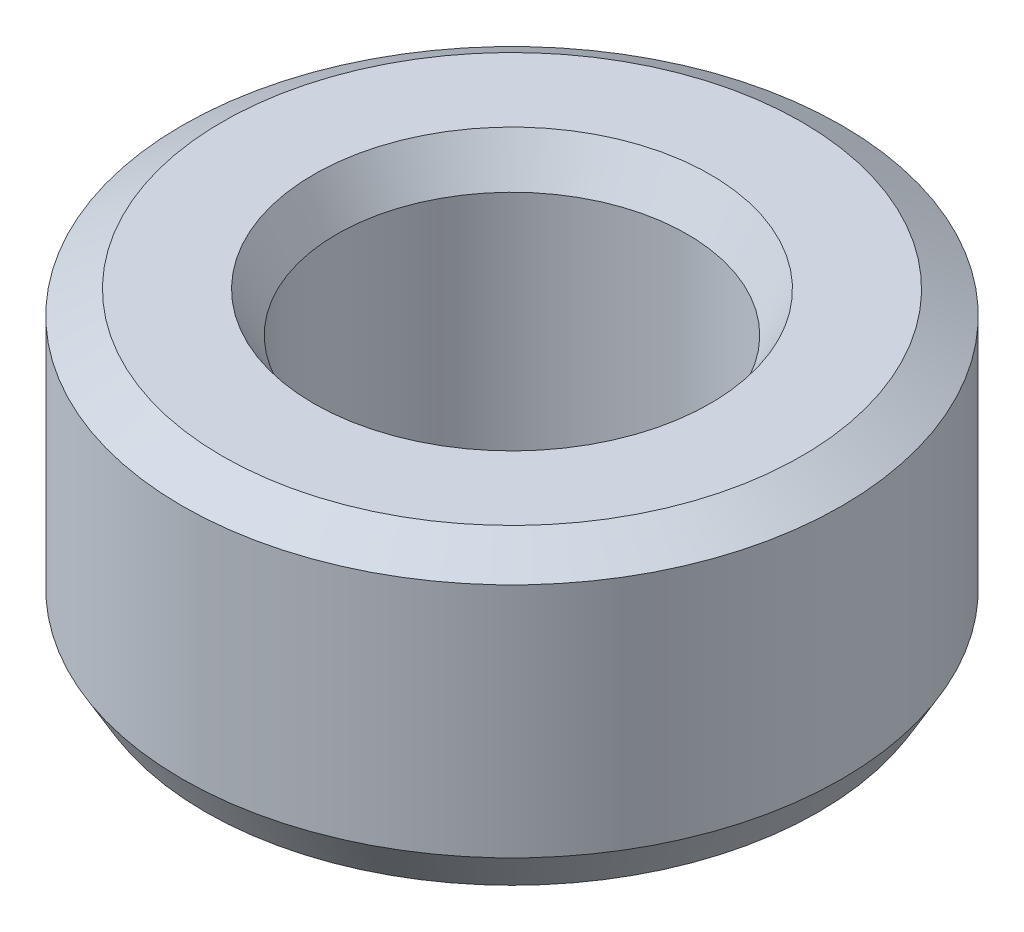
from build123d import *
from OCP.BRepFilletAPI import BRepFilletAPI_MakeChamfer

# Parameters (mm, degrees)
SKETCH1_R           = 12.5
BOSS_EXTRUDE1_DEPTH = 11.361416281
SKETCH2_R           = 6.64244607
CUT_EXTRUDE1_DEPTH  = 22.013847337
CHAMFER1_SIZE       = 0.877414403
CHAMFER1_SIZE2      = 1.519726325


with BuildPart() as part:
    # Sketch1 → Boss-Extrude1 (new body)
    with BuildSketch(Plane(origin=(0, 0, 0), x_dir=(1, 0, 0), z_dir=(0, 1, 0))):
        Circle(SKETCH1_R)
    extrude(amount=BOSS_EXTRUDE1_DEPTH)

    # Sketch2 → Cut-Extrude1 (cut, through all)
    with BuildSketch(Plane(origin=(0, 0, 0), x_dir=(1, 0, 0), z_dir=(0, 1, 0))):
        Circle(SKETCH2_R)
    extrude(amount=CUT_EXTRUDE1_DEPTH, mode=Mode.SUBTRACT)

    # Chamfer1: one chamfer whose edges measure the first distance from different faces: ONE call of the kernel's chamfer builder (chamfer() names one face for all edges)
    chamfer1_edges_1 = [part.edges().sort_by_distance(p)[0] for p in [
        (-6.64244607, 11.361416281, 0),
    ]]
    chamfer1_side_1 = [part.faces().sort_by_distance(p)[0] for p in [
        (-12.146446609, 11.361416281, 0),
    ]]
    chamfer1_edges_2 = [part.edges().sort_by_distance(p)[0] for p in [
        (-6.64244607, 0, 0),
    ]]
    chamfer1_side_2 = [part.faces().sort_by_distance(p)[0] for p in [
        (-6.64244607, 5.680708141, 0),
    ]]
    chamfer1_edges_3 = [part.edges().sort_by_distance(p)[0] for p in [
        (-12.5, 0, 0),
    ]]
    chamfer1_side_3 = [part.faces().sort_by_distance(p)[0] for p in [
        (-12.146446609, 0, 0),
    ]]
    chamfer1_edges_4 = [part.edges().sort_by_distance(p)[0] for p in [
        (-12.5, 11.361416281, 0),
    ]]
    chamfer1_side_4 = [part.faces().sort_by_distance(p)[0] for p in [
        (-12.5, 5.680708141, 0),
    ]]
    chamfer1 = BRepFilletAPI_MakeChamfer(part.part.solid().wrapped)
    for e in chamfer1_edges_1:
        chamfer1.Add(CHAMFER1_SIZE, CHAMFER1_SIZE2, e.wrapped, chamfer1_side_1[0].wrapped)  # the first distance lies on this face
    for e in chamfer1_edges_2:
        chamfer1.Add(CHAMFER1_SIZE, CHAMFER1_SIZE2, e.wrapped, chamfer1_side_2[0].wrapped)  # the first distance lies on this face
    for e in chamfer1_edges_3:
        chamfer1.Add(CHAMFER1_SIZE, CHAMFER1_SIZE2, e.wrapped, chamfer1_side_3[0].wrapped)  # the first distance lies on this face
    for e in chamfer1_edges_4:
        chamfer1.Add(CHAMFER1_SIZE, CHAMFER1_SIZE2, e.wrapped, chamfer1_side_4[0].wrapped)  # the first distance lies on this face
    add(Compound.cast(chamfer1.Shape()), mode=Mode.REPLACE)


solid = part.part
